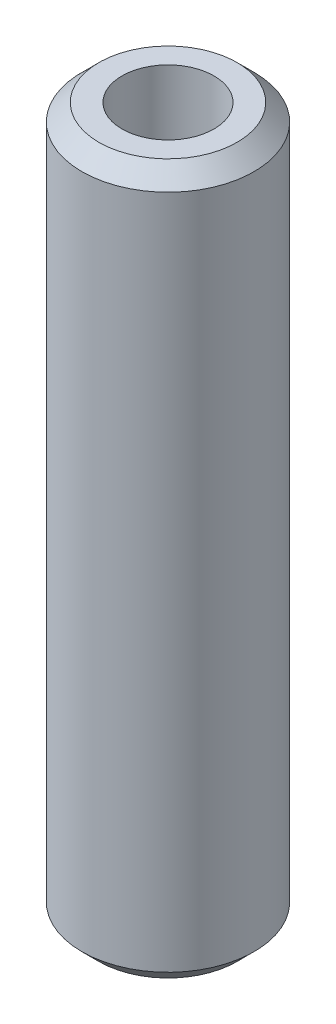
from build123d import *

# Parameters (mm, degrees)
SKETCH1_R           = 5
BOSS_EXTRUDE1_DEPTH = 41.216244654
SKETCH2_R           = 2.673555919
CUT_EXTRUDE1_DEPTH  = 42.818402927
CHAMFER1_SIZE       = 0.984070602


with BuildPart() as part:
    # Sketch1 → Boss-Extrude1 (new body)
    with BuildSketch(Plane(origin=(0, 0, 0), x_dir=(1, 0, 0), z_dir=(0, 1, 0))):
        Circle(SKETCH1_R)
    extrude(amount=BOSS_EXTRUDE1_DEPTH)

    # Sketch2 → Cut-Extrude1 (cut, through all)
    with BuildSketch(Plane(origin=(0, 0, 0), x_dir=(1, 0, 0), z_dir=(0, 1, 0))):
        Circle(SKETCH2_R)
    extrude(amount=CUT_EXTRUDE1_DEPTH, mode=Mode.SUBTRACT)

    # Chamfer1
    chamfer1_edges = [part.edges().sort_by_distance(p)[0] for p in [
        (-5, 41.216244654, 0),
        (-5, 0, 0),
    ]]
    chamfer(chamfer1_edges, length=CHAMFER1_SIZE)


solid = part.part
